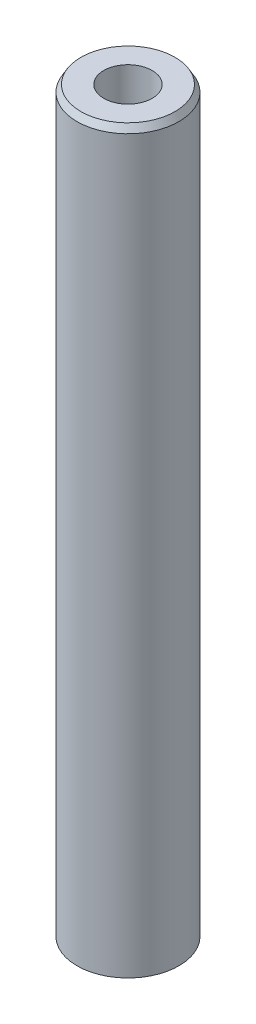
from build123d import *
from OCP.BRepFilletAPI import BRepFilletAPI_MakeChamfer

# Parameters (mm, degrees)
SKETCH1_R           = 20
BOSS_EXTRUDE1_DEPTH = 291.176222398
SKETCH2_R           = 9.496731365
CUT_EXTRUDE1_DEPTH  = 293.546735566
CHAMFER1_SIZE       = 2.649462913
CHAMFER1_SIZE2      = 1.529668126


with BuildPart() as part:
    # Sketch1 → Boss-Extrude1 (new body)
    with BuildSketch(Plane(origin=(0, 0, 0), x_dir=(1, 0, 0), z_dir=(0, 1, 0))):
        Circle(SKETCH1_R)
    extrude(amount=BOSS_EXTRUDE1_DEPTH)

    # Sketch2 → Cut-Extrude1 (cut, through all)
    with BuildSketch(Plane(origin=(0, 0, 0), x_dir=(1, 0, 0), z_dir=(0, 1, 0))):
        Circle(SKETCH2_R)
    extrude(amount=CUT_EXTRUDE1_DEPTH, mode=Mode.SUBTRACT)

    # Chamfer1: one chamfer whose edges measure the first distance from different faces: ONE call of the kernel's chamfer builder (chamfer() names one face for all edges)
    chamfer1_edges_1 = [part.edges().sort_by_distance(p)[0] for p in [
        (-20, 291.176222398, 0),
    ]]
    chamfer1_side_1 = [part.faces().sort_by_distance(p)[0] for p in [
        (-20, 145.588111199, 0),
    ]]
    chamfer1_edges_2 = [part.edges().sort_by_distance(p)[0] for p in [
        (-20, 0, 0),
    ]]
    chamfer1_side_2 = [part.faces().sort_by_distance(p)[0] for p in [
        (-19.434314575, 0, 0),
    ]]
    chamfer1 = BRepFilletAPI_MakeChamfer(part.part.solid().wrapped)
    for e in chamfer1_edges_1:
        chamfer1.Add(CHAMFER1_SIZE, CHAMFER1_SIZE2, e.wrapped, chamfer1_side_1[0].wrapped)  # the first distance lies on this face
    for e in chamfer1_edges_2:
        chamfer1.Add(CHAMFER1_SIZE, CHAMFER1_SIZE2, e.wrapped, chamfer1_side_2[0].wrapped)  # the first distance lies on this face
    add(Compound.cast(chamfer1.Shape()), mode=Mode.REPLACE)


solid = part.part
